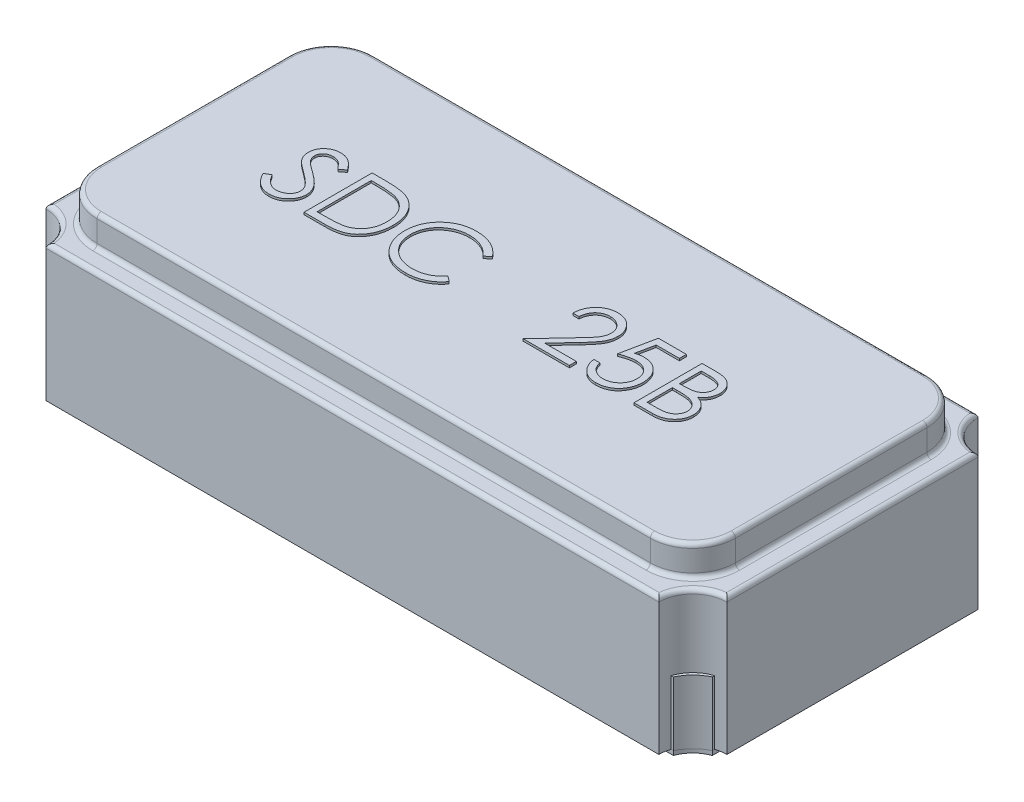
from build123d import *

# Parameters (mm, degrees)
EXTRUDE_2_DEPTH   = 0.02
EXTRUDE_2_2_DEPTH = 0.02
EXTRUDE_4_DEPTH   = 0.3
EXTRUDE_4_2_DEPTH = 0.3
EXTRUDE_4_3_DEPTH = 0.3
EXTRUDE_4_4_DEPTH = 0.3
EXTRUDE_8_DEPTH   = 0.64
SKETCH_7_W        = 3
SKETCH_7_H        = 1.3
EXTRUDE_9_DEPTH   = 0.14
FILLET_3_R        = 0.2
FILLET_4_R        = 0.02
FILLET_5_R        = 0.02
FILLET_6_R        = 0.02
EXTRUDE_10_DEPTH  = 0.01


with BuildPart() as part:
    # Эскиз2 → Бобышка-Вытянуть2 (new body)
    with BuildSketch(Plane(origin=(0, 0, 0), x_dir=(1, 0, 0), z_dir=(0, 1, 0))):
        with BuildLine():
            Line((-1.458578644, 0.7), (-0.825, 0.7))
            Line((-0.825, 0.7), (-0.825, 0.198360656))
            ThreePointArc((-0.825, 0.198360656), (-0.626639344, 0), (-0.825, -0.198360656))
            Line((-0.825, -0.198360656), (-0.825, -0.7))
            Line((-0.825, -0.7), (-1.458578644, -0.7))
            ThreePointArc((-1.458578644, -0.7), (-1.493933983, -0.643933983), (-1.55, -0.608578644))
            Line((-1.55, -0.608578644), (-1.55, 0.608578644))
            ThreePointArc((-1.55, 0.608578644), (-1.493933983, 0.643933983), (-1.458578644, 0.7))
        make_face()
    extrude(amount=EXTRUDE_2_DEPTH)


with BuildPart() as body_2:
    # Эскиз2 → Extrude 2 2 (new body)
    with BuildSketch(Plane(origin=(0, 0, 0), x_dir=(1, 0, 0), z_dir=(0, 1, 0))):
        with BuildLine():
            Line((1.55, 0.608578644), (1.55, -0.608578644))
            ThreePointArc((1.55, -0.608578644), (1.493933983, -0.643933983), (1.458578644, -0.7))
            Line((1.458578644, -0.7), (0.825, -0.7))
            Line((0.825, -0.7), (0.825, 0.7))
            Line((0.825, 0.7), (1.458578644, 0.7))
            ThreePointArc((1.458578644, 0.7), (1.493933983, 0.643933983), (1.55, 0.608578644))
        make_face()
    extrude(amount=EXTRUDE_2_2_DEPTH)


with BuildPart() as body_3:
    # Эскиз5 → Бобышка-Вытянуть4 (new body)
    with BuildSketch(Plane(origin=(0, 0.02, 0), x_dir=(-1, 0, 0), z_dir=(0, 1, 0))):
        with BuildLine():
            Line((1.458578644, 0.7), (1.436538459, 0.7))
            ThreePointArc((1.436538459, 0.7), (1.482556073, 0.632556073), (1.55, 0.586538459))
            Line((1.55, 0.586538459), (1.55, 0.608578644))
            ThreePointArc((1.55, 0.608578644), (1.496698209, 0.646698209), (1.458578644, 0.7))
        make_face()
    extrude(amount=EXTRUDE_4_DEPTH)


with BuildPart() as body_4:
    # Эскиз5 → Extrude 4 2 (new body)
    with BuildSketch(Plane(origin=(0, 0.02, 0), x_dir=(-1, 0, 0), z_dir=(0, 1, 0))):
        with BuildLine():
            Line((1.458578644, -0.7), (1.436538459, -0.7))
            ThreePointArc((1.436538459, -0.7), (1.482556073, -0.632556073), (1.55, -0.586538459))
            Line((1.55, -0.586538459), (1.55, -0.608578644))
            ThreePointArc((1.55, -0.608578644), (1.496698209, -0.646698209), (1.458578644, -0.7))
        make_face()
    extrude(amount=EXTRUDE_4_2_DEPTH)


with BuildPart() as body_5:
    # Эскиз5 → Extrude 4 3 (new body)
    with BuildSketch(Plane(origin=(0, 0.02, 0), x_dir=(-1, 0, 0), z_dir=(0, 1, 0))):
        with BuildLine():
            Line((-1.458578644, -0.7), (-1.436538459, -0.7))
            ThreePointArc((-1.436538459, -0.7), (-1.482556073, -0.632556073), (-1.55, -0.586538459))
            Line((-1.55, -0.586538459), (-1.55, -0.608578644))
            ThreePointArc((-1.55, -0.608578644), (-1.496698209, -0.646698209), (-1.458578644, -0.7))
        make_face()
    extrude(amount=EXTRUDE_4_3_DEPTH)


with BuildPart() as body_6:
    # Эскиз5 → Extrude 4 4 (new body)
    with BuildSketch(Plane(origin=(0, 0.02, 0), x_dir=(-1, 0, 0), z_dir=(0, 1, 0))):
        with BuildLine():
            Line((-1.55, 0.608578644), (-1.55, 0.586538459))
            ThreePointArc((-1.55, 0.586538459), (-1.482556073, 0.632556073), (-1.436538459, 0.7))
            Line((-1.436538459, 0.7), (-1.458578644, 0.7))
            ThreePointArc((-1.458578644, 0.7), (-1.496698209, 0.646698209), (-1.55, 0.608578644))
        make_face()
    extrude(amount=EXTRUDE_4_4_DEPTH)


with BuildPart() as body_7:
    # Эскиз6 → Бобышка-Вытянуть8 (new body)
    with BuildSketch(Plane(origin=(0, 0.02, 0), x_dir=(-1, 0, 0), z_dir=(0, 1, 0))):
        with BuildLine():
            Line((1.44, -0.75), (-1.44, -0.75))
            ThreePointArc((-1.44, -0.75), (-1.486862915, -0.636862915), (-1.6, -0.59))
            Line((-1.6, -0.59), (-1.6, 0.59))
            ThreePointArc((-1.6, 0.59), (-1.486862915, 0.636862915), (-1.44, 0.75))
            Line((-1.44, 0.75), (1.44, 0.75))
            ThreePointArc((1.44, 0.75), (1.486862915, 0.636862915), (1.6, 0.59))
            Line((1.6, 0.59), (1.6, -0.59))
            ThreePointArc((1.6, -0.59), (1.486862915, -0.636862915), (1.44, -0.75))
        make_face()
    extrude(amount=EXTRUDE_8_DEPTH)

    # Эскиз7 → Бобышка-Вытянуть9 (add)
    with BuildSketch(Plane(origin=(0, 0.66, 0), x_dir=(-1, 0, 0), z_dir=(0, 1, 0))):
        Rectangle(SKETCH_7_W, SKETCH_7_H)
    extrude(amount=EXTRUDE_9_DEPTH)

    # Скругление3
    # the kernel refuses this fillet: 0.2 mm, written as the material it takes off along each edge
    with BuildSketch(Plane(origin=(-1.5, 0.66, -0.65), x_dir=(1, 0, 0), z_dir=(0, 1, 0)), Plane(origin=(-1.5, 0.66, 0.65), x_dir=(0, 0, -1), z_dir=(0, 1, 0))) as fillet_3_piece_1:
        with BuildLine():
            CenterArc((FILLET_3_R, -FILLET_3_R), FILLET_3_R, 90, 90)
            Line((0, -FILLET_3_R), (0, 0))
            Line((0, 0), (FILLET_3_R, 0))
        make_face()
    extrude(amount=0.64, mode=Mode.SUBTRACT)
    with BuildSketch(Plane(origin=(1.5, 0.66, 0.65), x_dir=(0, 0, -1), z_dir=(0, 1, 0)), Plane(origin=(1.5, 0.66, -0.65), x_dir=(-1, 0, 0), z_dir=(0, 1, 0))) as fillet_3_piece_2:
        with BuildLine():
            CenterArc((FILLET_3_R, FILLET_3_R), FILLET_3_R, 180, 90)
            Line((0, FILLET_3_R), (0, 0))
            Line((0, 0), (FILLET_3_R, 0))
        make_face()
    extrude(amount=0.64, mode=Mode.SUBTRACT)

    # Скругление4
    fillet_4_edges = [body_7.edges().sort_by_distance(p)[0] for p in [
        (0, 0.8, -0.65),
        (1.5, 0.8, 0),
        (-1.5, 0.8, 0),
        (0, 0.8, 0.65),
        (-1.441421356, 0.8, 0.591421356),
        (-1.441421356, 0.8, -0.591421356),
        (1.441421356, 0.8, 0.591421356),
        (1.441421356, 0.8, -0.591421356),
    ]]
    fillet(fillet_4_edges, radius=FILLET_4_R)

    # Скругление5
    fillet_5_edges = [body_7.edges().sort_by_distance(p)[0] for p in [
        (0, 0.66, -0.65),
        (1.5, 0.66, 0),
        (0, 0.66, 0.65),
        (-1.5, 0.66, 0),
        (1.441421356, 0.66, -0.591421356),
        (1.441421356, 0.66, 0.591421356),
        (-1.441421356, 0.66, -0.591421356),
        (-1.441421356, 0.66, 0.591421356),
    ]]
    fillet(fillet_5_edges, radius=FILLET_5_R)

    # Скругление6
    fillet_6_edges = [body_7.edges().sort_by_distance(p)[0] for p in [
        (1.486862915, 0.66, 0.636862915),
        (1.6, 0.66, 0),
        (1.486862915, 0.66, -0.636862915),
        (0, 0.66, -0.75),
        (-1.486862915, 0.66, -0.636862915),
        (-1.6, 0.66, 0),
        (-1.486862915, 0.66, 0.636862915),
        (0, 0.66, 0.75),
    ]]
    fillet(fillet_6_edges, radius=FILLET_6_R)

    # Эскиз8 → Бобышка-Вытянуть10 (add)
    # profile 1 of 6: a face of its own
    with BuildSketch(Plane(origin=(0, 0.8, 0), x_dir=(-1, 0, 0), z_dir=(0, 1, 0))):
        with BuildLine():
            Line((1.065003615, 0.105091939), (1.037952333, 0.08887399))
            add(Edge.make_bspline(
                [(1.037952333, 0.08887399), (1.035436379, 0.093085591), (1.03061591, 0.101154856), (1.022574643, 0.112058448), (1.014242491, 0.121325846), (1.005557752, 0.128903135), (0.996573437, 0.134868748), (0.987230895, 0.139092952), (0.977561609, 0.141727555), (0.970981146, 0.142047563), (0.967695922, 0.142207324)],
                knots=[0, 0, 0, 0, 1.272034388, 2.437168799, 3.508375237, 4.49857839, 5.41946034, 6.295179144, 7.148887113, 8, 8, 8, 8], degree=3))
            add(Edge.make_bspline(
                [(0.967695922, 0.142207324), (0.964890834, 0.142127323), (0.95932974, 0.141968722), (0.951126874, 0.140506339), (0.943200091, 0.138113891), (0.935628286, 0.134870641), (0.92861171, 0.130884079), (0.92236114, 0.126182832), (0.917079843, 0.120751923), (0.912713642, 0.114787168), (0.909295708, 0.108413077), (0.906863767, 0.101786625), (0.90530154, 0.094950038), (0.905103473, 0.090313907), (0.905003615, 0.087976554)],
                knots=[0, 0, 0, 0, 1.095645842, 2.172120455, 3.244862764, 4.326153987, 5.384857088, 6.392105572, 7.372507978, 8.334705661, 9.272564127, 10.189475455, 11.087205874, 12, 12, 12, 12], degree=3))
            add(Edge.make_bspline(
                [(0.905003615, 0.087976554), (0.905135514, 0.085311359), (0.905402624, 0.079914047), (0.907756681, 0.071937323), (0.911351228, 0.064009345), (0.914729699, 0.059104456), (0.916477974, 0.056566298)],
                knots=[0, 0, 0, 0, 0.938992559, 1.901562324, 2.914110574, 4, 4, 4, 4], degree=3))
            add(Edge.make_bspline(
                [(0.916477974, 0.056566298), (0.917906449, 0.054729467), (0.920914157, 0.050861949), (0.926160993, 0.045206113), (0.932126976, 0.039217626), (0.938966567, 0.033016017), (0.946580032, 0.026474429), (0.955053684, 0.019714182), (0.964288581, 0.01263445), (0.970802222, 0.007958491), (0.974170281, 0.005540657)],
                knots=[0, 0, 0, 0, 0.722283655, 1.520795216, 2.39349503, 3.346893347, 4.386874146, 5.510198126, 6.712579003, 8, 8, 8, 8], degree=3))
            add(Edge.make_bspline(
                [(0.974170281, 0.005540657), (0.977536598, 0.003142066), (0.983972738, -0.001443858), (0.992980471, -0.008241268), (1.001024568, -0.014495636), (1.008146017, -0.020119842), (1.014160578, -0.025359184), (1.019288125, -0.029932863), (1.023339484, -0.034085108), (1.02559397, -0.03677658), (1.026606179, -0.037984984)],
                knots=[0, 0, 0, 0, 1.452255772, 2.776602448, 3.96446981, 5.032613149, 5.964194703, 6.766668629, 7.446264616, 8, 8, 8, 8], degree=3))
            add(Edge.make_bspline(
                [(1.026606179, -0.037984984), (1.028020574, -0.039868601), (1.030802173, -0.043572986), (1.034477872, -0.049361355), (1.037577599, -0.05527542), (1.0400723, -0.061336615), (1.04208967, -0.067499387), (1.04349226, -0.073810002), (1.044356787, -0.080225622), (1.04444609, -0.084542135), (1.044490794, -0.086702933)],
                knots=[0, 0, 0, 0, 1.068019517, 2.100403715, 3.106014851, 4.09224787, 5.069873182, 6.043214339, 7.020455327, 8, 8, 8, 8], degree=3))
            add(Edge.make_bspline(
                [(1.044490794, -0.086702933), (1.044371987, -0.090088802), (1.044136911, -0.096788171), (1.042132434, -0.106569638), (1.03900599, -0.115937276), (1.034482743, -0.124682595), (1.028895686, -0.132793199), (1.022263838, -0.140125211), (1.014463005, -0.146426255), (1.005778685, -0.151782646), (0.996384041, -0.156055852), (0.986510821, -0.159169577), (0.97620339, -0.16099441), (0.969198806, -0.161251813), (0.96564464, -0.16138242)],
                knots=[0, 0, 0, 0, 1.005367131, 1.989245246, 2.955191616, 3.932180104, 4.904534562, 5.875498653, 6.859376768, 7.874484044, 8.900379497, 9.918679785, 10.943926428, 12, 12, 12, 12], degree=3))
            add(Edge.make_bspline(
                [(0.96564464, -0.16138242), (0.961872586, -0.16125655), (0.95439215, -0.161006935), (0.943385565, -0.158703118), (0.932725191, -0.155123587), (0.924181738, -0.150860434), (0.917492768, -0.146648447), (0.912397073, -0.14280227), (0.907205168, -0.138383946), (0.901972993, -0.133299876), (0.896648854, -0.127651878), (0.891257287, -0.121392104), (0.885747833, -0.114576974), (0.88220464, -0.109710526), (0.88038823, -0.107215753)],
                knots=[0, 0, 0, 0, 1.286534051, 2.551350862, 3.822568981, 5.117864672, 5.799956111, 6.519305446, 7.295594771, 8.126302591, 9.008831062, 9.944975596, 10.946496709, 12, 12, 12, 12], degree=3))
            Line((0.88038823, -0.107215753), (0.906349768, -0.087536266))
            add(Edge.make_bspline(
                [(0.906349768, -0.087536266), (0.907917282, -0.08955592), (0.910935947, -0.093445302), (0.915520735, -0.098890267), (0.919835459, -0.103870759), (0.92411904, -0.108185316), (0.928041285, -0.112157077), (0.931915707, -0.115497085), (0.935592632, -0.118311376), (0.940216774, -0.121318686), (0.946089448, -0.12422828), (0.953392672, -0.126729838), (0.961029786, -0.128267193), (0.966214454, -0.128462589), (0.968849768, -0.128561907)],
                knots=[0, 0, 0, 0, 1.181426797, 2.275151783, 3.28963443, 4.225459815, 5.084396437, 5.868484344, 6.587427557, 7.222918358, 8.415355282, 9.605213164, 10.782753814, 12, 12, 12, 12], degree=3))
            add(Edge.make_bspline(
                [(0.968849768, -0.128561907), (0.972156288, -0.128452937), (0.978532599, -0.128242799), (0.987564004, -0.125887382), (0.995739679, -0.122306129), (1.002747519, -0.117142), (1.008533784, -0.110985363), (1.012771288, -0.103964152), (1.015304817, -0.096209498), (1.015614917, -0.090802688), (1.015772845, -0.088049087)],
                knots=[0, 0, 0, 0, 1.144248881, 2.206576175, 3.214949548, 4.222996039, 5.203671638, 6.127710127, 7.046472867, 8, 8, 8, 8], degree=3))
            add(Edge.make_bspline(
                [(1.015772845, -0.088049087), (1.015733151, -0.086335509), (1.015653208, -0.082884484), (1.014700098, -0.077796311), (1.013277781, -0.072768037), (1.011261686, -0.067770692), (1.00852179, -0.062661907), (1.004800529, -0.057470801), (1.000143864, -0.052067452), (0.996569996, -0.048556572), (0.994683102, -0.046702933)],
                knots=[0, 0, 0, 0, 0.858500039, 1.728959331, 2.587258638, 3.476905708, 4.426389682, 5.487945037, 6.673710648, 8, 8, 8, 8], degree=3))
            add(Edge.make_bspline(
                [(0.994683102, -0.046702933), (0.993982633, -0.046077833), (0.992318481, -0.04459274), (0.989276111, -0.042161446), (0.985258483, -0.039162335), (0.980370511, -0.035451495), (0.974522066, -0.031146904), (0.967712507, -0.026303602), (0.960017738, -0.02076436), (0.954557449, -0.016891671), (0.951670281, -0.014843958)],
                knots=[0, 0, 0, 0, 0.420754252, 0.999615792, 1.744751191, 2.668019286, 3.750313428, 4.999500688, 6.413464383, 8, 8, 8, 8], degree=3))
            add(Edge.make_bspline(
                [(0.951670281, -0.014843958), (0.948197286, -0.012316747), (0.941472312, -0.007423151), (0.931903586, -7.0885e-05), (0.923227694, 0.007119851), (0.915413534, 0.014102669), (0.908386058, 0.020826163), (0.902216106, 0.027366009), (0.896875684, 0.033679321), (0.891047821, 0.041718339), (0.885163407, 0.051682995), (0.880118006, 0.063897082), (0.876908208, 0.076146219), (0.876491344, 0.084368473), (0.876285666, 0.088425272)],
                knots=[0, 0, 0, 0, 1.163604038, 2.253157948, 3.268574773, 4.215621239, 5.091738613, 5.902582348, 6.650434646, 7.330118262, 8.591011492, 9.77460283, 10.902005569, 12, 12, 12, 12], degree=3))
            add(Edge.make_bspline(
                [(0.876285666, 0.088425272), (0.876345842, 0.091294098), (0.876465025, 0.09697604), (0.877831504, 0.105320132), (0.879840705, 0.113420659), (0.882835179, 0.121176812), (0.886578358, 0.128675035), (0.891135648, 0.13590218), (0.896658566, 0.142739498), (0.902793864, 0.149319771), (0.909608628, 0.155270978), (0.91682004, 0.160571624), (0.924387623, 0.165110156), (0.932397799, 0.168675727), (0.940718618, 0.171527879), (0.949389138, 0.173572227), (0.95842799, 0.174831202), (0.964572123, 0.17496156), (0.967695922, 0.175027836)],
                knots=[0, 0, 0, 0, 0.98378539, 1.948466333, 2.894822735, 3.844243623, 4.795447569, 5.768042124, 6.770299647, 7.807997672, 8.852593179, 9.870666288, 10.876941106, 11.874841786, 12.874492863, 13.892063892, 14.928283473, 16, 16, 16, 16], degree=3))
            add(Edge.make_bspline(
                [(0.967695922, 0.175027836), (0.970112761, 0.174980564), (0.974916002, 0.174886615), (0.982001505, 0.174075723), (0.988956897, 0.17288654), (0.995694847, 0.171073468), (1.002299244, 0.168821915), (1.008711251, 0.166065234), (1.014946333, 0.162783468), (1.021012194, 0.158971541), (1.026964353, 0.154577284), (1.032778788, 0.149503652), (1.038484605, 0.143774929), (1.044105507, 0.137399087), (1.049509085, 0.13027074), (1.054831223, 0.122502933), (1.060044209, 0.114070573), (1.063319602, 0.108140718), (1.065003615, 0.105091939)],
                knots=[0, 0, 0, 0, 0.915366252, 1.81920441, 2.69897508, 3.586533125, 4.459536084, 5.340758185, 6.227946952, 7.126403341, 8.052553006, 9.028121456, 10.047063623, 11.114014537, 12.24582441, 13.433687931, 14.680555077, 16, 16, 16, 16], degree=3))
        make_face()
    # profile 2 of 6: a face of its own
    with BuildSketch(Plane(origin=(0, 0.8, 0), x_dir=(-1, 0, 0), z_dir=(0, 1, 0))):
        with BuildLine():
            Line((0.81064464, 0.166822708), (0.81064464, -0.153177292))
            Line((0.81064464, -0.153177292), (0.746029256, -0.153177292))
            add(Edge.make_bspline(
                [(0.746029256, -0.153177292), (0.740409222, -0.153136938), (0.729551347, -0.153058976), (0.713861222, -0.152561829), (0.699364556, -0.151691255), (0.686069579, -0.150398701), (0.673954934, -0.148847274), (0.663040022, -0.146874246), (0.653307155, -0.144553831), (0.647321389, -0.142574725), (0.644490794, -0.14163883)],
                knots=[0, 0, 0, 0, 1.314317071, 2.539253741, 3.67075822, 4.709970291, 5.662644612, 6.526156501, 7.303037452, 8, 8, 8, 8], degree=3))
            add(Edge.make_bspline(
                [(0.644490794, -0.14163883), (0.640788087, -0.140228461), (0.633466637, -0.137439704), (0.623047936, -0.132171058), (0.613206628, -0.126225862), (0.604020422, -0.119467811), (0.595469076, -0.111983267), (0.587444996, -0.103832785), (0.580178177, -0.094798774), (0.573417984, -0.085161557), (0.567501061, -0.074833433), (0.562283473, -0.064021273), (0.557828444, -0.052746056), (0.554352325, -0.040925511), (0.55148045, -0.02867317), (0.549553493, -0.015896269), (0.548273492, -0.002669297), (0.548145487, 0.00630677), (0.548080538, 0.01086117)],
                knots=[0, 0, 0, 0, 0.984696416, 1.947063185, 2.89840987, 3.841051395, 4.778753227, 5.721858861, 6.681155121, 7.65838316, 8.646299769, 9.637283673, 10.641736726, 11.657050558, 12.698485921, 13.768600492, 14.86780186, 16, 16, 16, 16], degree=3))
            add(Edge.make_bspline(
                [(0.548080538, 0.01086117), (0.548138082, 0.01481647), (0.548251479, 0.022610801), (0.549268461, 0.034098161), (0.550749468, 0.045243843), (0.553031865, 0.055998908), (0.55583642, 0.066435767), (0.559297956, 0.076505003), (0.563400756, 0.086213459), (0.568158838, 0.095484024), (0.573368744, 0.104294156), (0.579045792, 0.112504263), (0.584995603, 0.120204866), (0.591435178, 0.127221998), (0.598151309, 0.133774177), (0.605372421, 0.139570746), (0.612872412, 0.144880811), (0.620876604, 0.149543113), (0.629450668, 0.153690369), (0.638818571, 0.157192752), (0.648946123, 0.160206813), (0.659900431, 0.162608211), (0.671644962, 0.164543859), (0.684211551, 0.165832902), (0.697576668, 0.166707033), (0.706754231, 0.166783401), (0.711477974, 0.166822708)],
                knots=[0, 0, 0, 0, 1.105894396, 2.179280415, 3.222964075, 4.248423888, 5.251546139, 6.243661943, 7.223682738, 8.196462441, 9.155694589, 10.083899862, 10.986397372, 11.874737962, 12.745335529, 13.607670254, 14.461432187, 15.313100333, 16.195087267, 17.121790994, 18.106827133, 19.14775296, 20.255889161, 21.433815148, 22.679170477, 24, 24, 24, 24], degree=3))
            Line((0.711477974, 0.166822708), (0.81064464, 0.166822708))
        make_face()
        with BuildLine():
            Line((0.781926692, 0.134002195), (0.745195922, 0.134002195))
            add(Edge.make_bspline(
                [(0.745195922, 0.134002195), (0.7399179, 0.133979512), (0.72976633, 0.133935884), (0.715169027, 0.133553054), (0.701831482, 0.132927506), (0.689751801, 0.13205207), (0.678936805, 0.130893797), (0.669363891, 0.129602377), (0.661064438, 0.127993467), (0.656042318, 0.126535094), (0.653721563, 0.12586117)],
                knots=[0, 0, 0, 0, 1.375205317, 2.645023457, 3.804390687, 4.853969522, 5.800190428, 6.637939096, 7.370582563, 8, 8, 8, 8], degree=3))
            add(Edge.make_bspline(
                [(0.653721563, 0.12586117), (0.650800508, 0.124832533), (0.645028167, 0.122799828), (0.636719937, 0.119090587), (0.628967414, 0.11470227), (0.621641355, 0.109795518), (0.614788843, 0.104294567), (0.60844161, 0.098181922), (0.602549523, 0.09152835), (0.597206918, 0.084311433), (0.592374956, 0.076611245), (0.588200157, 0.068436364), (0.584680848, 0.059832664), (0.581793489, 0.05083008), (0.579542339, 0.041423253), (0.577957441, 0.031588576), (0.576975299, 0.021329934), (0.576858066, 0.014346304), (0.576798486, 0.010797067)],
                knots=[0, 0, 0, 0, 0.998420628, 1.972994, 2.929372424, 3.86770908, 4.81360496, 5.759023883, 6.706048443, 7.676227424, 8.651287839, 9.634325482, 10.632389399, 11.645655052, 12.680158286, 13.74837235, 14.855672678, 16, 16, 16, 16], degree=3))
            add(Edge.make_bspline(
                [(0.576798486, 0.010797067), (0.576845466, 0.0070546), (0.576937756, -0.00029751), (0.578095841, -0.011085548), (0.57979181, -0.021459771), (0.582231329, -0.031427647), (0.585382976, -0.040976208), (0.589154178, -0.0501594), (0.593733009, -0.058859042), (0.59891673, -0.067148819), (0.604736406, -0.074903186), (0.611166221, -0.082031297), (0.618138377, -0.08854643), (0.625620742, -0.094458958), (0.633717931, -0.099663735), (0.642292923, -0.104293823), (0.65146651, -0.108227822), (0.657849506, -0.11031945), (0.661093358, -0.11138242)],
                knots=[0, 0, 0, 0, 1.122272916, 2.204715076, 3.251197285, 4.274229216, 5.279697671, 6.265416158, 7.248880903, 8.225321784, 9.195852973, 10.153576302, 11.101466393, 12.055578741, 13.010401466, 13.985536859, 14.976245305, 16, 16, 16, 16], degree=3))
            add(Edge.make_bspline(
                [(0.661093358, -0.11138242), (0.663776892, -0.112124493), (0.66948282, -0.113702345), (0.678793857, -0.115423522), (0.689272956, -0.116941648), (0.700966643, -0.118226954), (0.713861588, -0.119149223), (0.727967708, -0.119841458), (0.7432911, -0.12030835), (0.753913503, -0.120340232), (0.759426692, -0.120356779)],
                knots=[0, 0, 0, 0, 0.674548936, 1.434276114, 2.292660221, 3.240891867, 4.284742987, 5.42552168, 6.663806718, 8, 8, 8, 8], degree=3))
            Line((0.759426692, -0.120356779), (0.781926692, -0.120356779))
            Line((0.781926692, -0.120356779), (0.781926692, 0.134002195))
        make_face(mode=Mode.SUBTRACT)
    # profile 3 of 6: a face of its own
    with BuildSketch(Plane(origin=(0, 0.8, 0), x_dir=(-1, 0, 0), z_dir=(0, 1, 0))):
        with BuildLine():
            Line((0.187054897, -0.094459343), (0.212183102, -0.075228574))
            add(Edge.make_bspline(
                [(0.212183102, -0.075228574), (0.213975659, -0.077364863), (0.217536604, -0.081608639), (0.223265176, -0.087568327), (0.229236622, -0.093149883), (0.235442634, -0.09838917), (0.242026835, -0.10307561), (0.248738347, -0.107574187), (0.255821029, -0.111512845), (0.26556529, -0.11632441), (0.27836215, -0.121235801), (0.294415622, -0.125460021), (0.311196954, -0.128123718), (0.322643154, -0.128414171), (0.328465153, -0.128561907)],
                knots=[0, 0, 0, 0, 0.75789156, 1.505565099, 2.245254514, 2.979266606, 3.711207489, 4.440978832, 5.174393176, 5.91211879, 7.394186119, 8.890401545, 10.418332761, 12, 12, 12, 12], degree=3))
            add(Edge.make_bspline(
                [(0.328465153, -0.128561907), (0.33167273, -0.128524807), (0.338058115, -0.12845095), (0.347535122, -0.127483433), (0.356853113, -0.126107914), (0.365977439, -0.124116565), (0.374889982, -0.121524009), (0.383658603, -0.118483633), (0.392180034, -0.114700195), (0.400556819, -0.110521887), (0.408581998, -0.105801188), (0.416176709, -0.100653679), (0.423306701, -0.095130213), (0.429990106, -0.089243843), (0.436159579, -0.082925848), (0.441880661, -0.076247215), (0.44714605, -0.069177783), (0.451950312, -0.061751331), (0.456247421, -0.054004542), (0.459973713, -0.045970693), (0.463123524, -0.037680475), (0.465678849, -0.029151655), (0.467678751, -0.020414422), (0.469063109, -0.011437493), (0.470021713, -0.00223656), (0.470094919, 0.003999701), (0.47013182, 0.007143221)],
                knots=[0, 0, 0, 0, 1.054960097, 2.100129169, 3.131228542, 4.15308236, 5.169990287, 6.183953224, 7.204064171, 8.235355279, 9.262684623, 10.264978336, 11.252191258, 12.228402777, 13.192898315, 14.155264692, 15.119862721, 16.091023151, 17.063429752, 18.032246104, 19.00241354, 19.978852882, 20.959535218, 21.948948728, 22.966123959, 24, 24, 24, 24], degree=3))
            add(Edge.make_bspline(
                [(0.47013182, 0.007143221), (0.470016183, 0.011872836), (0.469789145, 0.021158809), (0.467777138, 0.03476219), (0.464695136, 0.047806748), (0.460151681, 0.06020416), (0.454437565, 0.072057774), (0.447307924, 0.08322384), (0.439019299, 0.093865943), (0.429486657, 0.103726339), (0.41902642, 0.112733181), (0.407803827, 0.120664697), (0.395846388, 0.127276334), (0.383286244, 0.132778137), (0.370026712, 0.137007323), (0.356091645, 0.139984615), (0.341511348, 0.141926757), (0.331548431, 0.142112694), (0.326477974, 0.142207324)],
                knots=[0, 0, 0, 0, 1.029159485, 2.020618137, 2.987588728, 3.942669054, 4.889339625, 5.846988364, 6.821327795, 7.821533711, 8.827683044, 9.822769455, 10.807800696, 11.797391277, 12.803701919, 13.832062008, 14.896664671, 16, 16, 16, 16], degree=3))
            add(Edge.make_bspline(
                [(0.326477974, 0.142207324), (0.320891442, 0.142052921), (0.309895811, 0.141749019), (0.293770735, 0.13917446), (0.278334322, 0.135000021), (0.263585743, 0.129157926), (0.249566575, 0.121563385), (0.23625488, 0.112356722), (0.223639422, 0.10145036), (0.216053477, 0.09312276), (0.212183102, 0.08887399)],
                knots=[0, 0, 0, 0, 1.028121516, 2.023589091, 2.998037872, 3.967518031, 4.937445131, 5.927275754, 6.942489185, 8, 8, 8, 8], degree=3))
            Line((0.212183102, 0.08887399), (0.187054897, 0.107912452))
            add(Edge.make_bspline(
                [(0.187054897, 0.107912452), (0.189077192, 0.110521596), (0.193112096, 0.115727386), (0.199644389, 0.123067787), (0.206530665, 0.129966257), (0.213789513, 0.136386869), (0.221430412, 0.142361716), (0.229450019, 0.147863016), (0.237808337, 0.152951795), (0.246515832, 0.157564175), (0.255572979, 0.161668423), (0.264902162, 0.165255526), (0.27452047, 0.168267591), (0.284352054, 0.170798349), (0.294497933, 0.172605793), (0.304842022, 0.174044243), (0.31548063, 0.174897827), (0.322651677, 0.174984111), (0.326285666, 0.175027836)],
                knots=[0, 0, 0, 0, 0.986880684, 1.969034265, 2.935876267, 3.899990983, 4.864973347, 5.834408638, 6.8063673, 7.789580233, 8.778939794, 9.778051223, 10.776304221, 11.791326552, 12.811423977, 13.855999788, 14.91350973, 16, 16, 16, 16], degree=3))
            add(Edge.make_bspline(
                [(0.326285666, 0.175027836), (0.329727373, 0.175003883), (0.336532921, 0.174956518), (0.346580807, 0.174189234), (0.356362712, 0.173142401), (0.365850678, 0.17156616), (0.375096481, 0.169706106), (0.384016306, 0.167212734), (0.392697925, 0.164419667), (0.401106459, 0.161136926), (0.40924906, 0.157432589), (0.417099466, 0.153245932), (0.424654065, 0.148612162), (0.431987132, 0.143633418), (0.43899034, 0.138149779), (0.445724377, 0.132237401), (0.452227003, 0.125916211), (0.456250106, 0.121358053), (0.458272845, 0.119066298)],
                knots=[0, 0, 0, 0, 1.114604814, 2.203992996, 3.262667896, 4.300477797, 5.318619304, 6.316056647, 7.298880507, 8.271930387, 9.238335007, 10.195173496, 11.151986948, 12.108099108, 13.064862484, 14.031167946, 15.010108607, 16, 16, 16, 16], degree=3))
            add(Edge.make_bspline(
                [(0.458272845, 0.119066298), (0.461512464, 0.115085307), (0.467952591, 0.107171388), (0.476195764, 0.09434645), (0.483228351, 0.080968052), (0.48897793, 0.066958703), (0.493394277, 0.052312959), (0.496499256, 0.037054378), (0.498502894, 0.021213464), (0.49873287, 0.010439967), (0.498849768, 0.004963734)],
                knots=[0, 0, 0, 0, 0.994611881, 1.977215934, 2.950189954, 3.921972279, 4.908960509, 5.911694611, 6.938501887, 8, 8, 8, 8], degree=3))
            add(Edge.make_bspline(
                [(0.498849768, 0.004963734), (0.498706943, -0.000791952), (0.498425944, -0.012115906), (0.496058262, -0.028738676), (0.49220322, -0.044641548), (0.4868948, -0.059885714), (0.479891576, -0.074383951), (0.471413606, -0.088197492), (0.461378082, -0.101315057), (0.449911039, -0.113568938), (0.437332792, -0.124772238), (0.423863816, -0.134628883), (0.409529421, -0.142831606), (0.394487801, -0.149688404), (0.37862625, -0.154958753), (0.361978629, -0.158648188), (0.344576213, -0.16094461), (0.332703077, -0.161234915), (0.326670281, -0.16138242)],
                knots=[0, 0, 0, 0, 1.032901378, 2.032168977, 3.007206631, 3.966850309, 4.924221947, 5.891988639, 6.871730993, 7.884084801, 8.900290346, 9.89161143, 10.874607481, 11.860025555, 12.854717796, 13.869097222, 14.917278314, 16, 16, 16, 16], degree=3))
            add(Edge.make_bspline(
                [(0.326670281, -0.16138242), (0.322993534, -0.161338333), (0.315715784, -0.161251068), (0.304949757, -0.160400299), (0.294468432, -0.158981624), (0.284242651, -0.157048205), (0.274255549, -0.154643404), (0.264552007, -0.151632275), (0.255159828, -0.147991621), (0.246015682, -0.143939663), (0.237236812, -0.139299077), (0.228827584, -0.13425497), (0.22085628, -0.128710207), (0.213271082, -0.122745658), (0.206107059, -0.116315439), (0.199256694, -0.109527632), (0.192923389, -0.102202179), (0.189014642, -0.097045013), (0.187054897, -0.094459343)],
                knots=[0, 0, 0, 0, 1.096566765, 2.170543479, 3.218870886, 4.250164525, 5.273529809, 6.281496242, 7.278154839, 8.276706968, 9.263143576, 10.238168486, 11.199979644, 12.157579042, 13.114563119, 14.070017788, 15.032356758, 16, 16, 16, 16], degree=3))
        make_face()
    # profile 4 of 6: a face of its own
    with BuildSketch(Plane(origin=(0, 0.8, 0), x_dir=(-1, 0, 0), z_dir=(0, 1, 0))):
        with BuildLine():
            Line((-0.260124591, -0.054715753), (-0.231406642, -0.054715753))
            add(Edge.make_bspline(
                [(-0.231406642, -0.054715753), (-0.231593778, -0.058525682), (-0.231961309, -0.06600828), (-0.233683204, -0.076917629), (-0.236144738, -0.087346458), (-0.239633306, -0.097205359), (-0.243941384, -0.106612106), (-0.249215717, -0.115441788), (-0.255343866, -0.123782037), (-0.262314588, -0.131474947), (-0.269878465, -0.138507228), (-0.277990175, -0.144644226), (-0.286566348, -0.149770063), (-0.295532595, -0.154078448), (-0.304992615, -0.157308488), (-0.314855981, -0.159706177), (-0.325167274, -0.161148508), (-0.332192639, -0.161303562), (-0.335765616, -0.16138242)],
                knots=[0, 0, 0, 0, 1.100776268, 2.161895295, 3.184016182, 4.190939212, 5.176500551, 6.166955529, 7.155448256, 8.160289653, 9.16017456, 10.133824356, 11.091467644, 12.04088621, 13.000931625, 13.972173743, 14.968683325, 16, 16, 16, 16], degree=3))
            add(Edge.make_bspline(
                [(-0.335765616, -0.16138242), (-0.339274716, -0.161300942), (-0.346169971, -0.161140841), (-0.35622929, -0.159745259), (-0.365828293, -0.157606655), (-0.374858195, -0.15443758), (-0.383411668, -0.150461085), (-0.391382804, -0.145515792), (-0.398964356, -0.139835696), (-0.405784233, -0.133135745), (-0.412049113, -0.125986879), (-0.41744906, -0.118351951), (-0.422099538, -0.1104572), (-0.425905808, -0.102240958), (-0.42879113, -0.093676466), (-0.430928878, -0.084845838), (-0.432150929, -0.07564716), (-0.432337453, -0.069420096), (-0.432432283, -0.066254215)],
                knots=[0, 0, 0, 0, 1.111674182, 2.184400057, 3.212814286, 4.223731311, 5.211378316, 6.196328225, 7.191884489, 8.207283132, 9.220262353, 10.201199469, 11.166417575, 12.120932471, 13.06540007, 14.026332106, 14.996573967, 16, 16, 16, 16], degree=3))
            add(Edge.make_bspline(
                [(-0.432432283, -0.066254215), (-0.432277468, -0.061797272), (-0.431970555, -0.052961599), (-0.429345276, -0.039977355), (-0.425244888, -0.027397492), (-0.420308424, -0.017272594), (-0.415327107, -0.009114875), (-0.410842707, -0.002394897), (-0.405563119, 0.00483881), (-0.39953345, 0.012615522), (-0.392649861, 0.020833397), (-0.385091185, 0.029660103), (-0.376662218, 0.038932426), (-0.370751486, 0.045269674), (-0.367688693, 0.048553477)],
                knots=[0, 0, 0, 0, 1.184416499, 2.348048165, 3.509039915, 4.696071444, 5.333504901, 6.05069495, 6.844171097, 7.714965912, 8.667477798, 9.695072654, 10.805644396, 12, 12, 12, 12], degree=3))
            Line((-0.367688693, 0.048553477), (-0.287624591, 0.134002195))
            Line((-0.287624591, 0.134002195), (-0.436534847, 0.134002195))
            Line((-0.436534847, 0.134002195), (-0.436534847, 0.166822708))
            Line((-0.436534847, 0.166822708), (-0.21909895, 0.166822708))
            Line((-0.21909895, 0.166822708), (-0.343201514, 0.034386811))
            add(Edge.make_bspline(
                [(-0.343201514, 0.034386811), (-0.346223249, 0.031232852), (-0.352027383, 0.025174743), (-0.360233261, 0.016327409), (-0.367615315, 0.008129252), (-0.37417844, 0.000543945), (-0.379928038, -0.00638551), (-0.384845712, -0.012713419), (-0.388953196, -0.018385477), (-0.393306274, -0.025048774), (-0.397457223, -0.03319392), (-0.401105482, -0.043097645), (-0.403314089, -0.053315299), (-0.403580385, -0.060217996), (-0.403714334, -0.063690112)],
                knots=[0, 0, 0, 0, 1.329530082, 2.553755191, 3.672934919, 4.687409497, 5.60679272, 6.413407421, 7.126401618, 7.737995624, 8.834647426, 9.90044882, 10.943907757, 12, 12, 12, 12], degree=3))
            add(Edge.make_bspline(
                [(-0.403714334, -0.063690112), (-0.403656806, -0.065873796), (-0.40354343, -0.070177416), (-0.402523873, -0.076483052), (-0.401025943, -0.082589158), (-0.39871717, -0.088420236), (-0.395943263, -0.094090971), (-0.392399393, -0.099428957), (-0.388349681, -0.104616152), (-0.383652212, -0.109474691), (-0.378495265, -0.113925868), (-0.373046471, -0.117868557), (-0.367281936, -0.121163583), (-0.361225684, -0.123864697), (-0.354894673, -0.125983591), (-0.348276639, -0.127451803), (-0.341389872, -0.12837363), (-0.336687381, -0.128498355), (-0.334291257, -0.128561907)],
                knots=[0, 0, 0, 0, 0.991504627, 1.954065223, 2.895985987, 3.842598665, 4.797835564, 5.759220273, 6.74786863, 7.784730864, 8.824135544, 9.839918996, 10.835834653, 11.835434876, 12.84861661, 13.863796685, 14.911511676, 16, 16, 16, 16], degree=3))
            add(Edge.make_bspline(
                [(-0.334291257, -0.128561907), (-0.331788142, -0.128499132), (-0.326872437, -0.128375852), (-0.319670602, -0.127441494), (-0.3127522, -0.126026457), (-0.306223842, -0.123773728), (-0.299948899, -0.121137204), (-0.29408745, -0.117723369), (-0.288474839, -0.113822534), (-0.283223909, -0.109274409), (-0.278441446, -0.104140261), (-0.274090797, -0.098551831), (-0.270404448, -0.092410048), (-0.267132114, -0.085862286), (-0.264629425, -0.078728651), (-0.262489805, -0.071183605), (-0.260935616, -0.063119497), (-0.260399422, -0.057563527), (-0.260124591, -0.054715753)],
                knots=[0, 0, 0, 0, 1.031072318, 2.024855787, 2.988461151, 3.935103592, 4.865765533, 5.788564469, 6.724086513, 7.67908574, 8.64457978, 9.611397706, 10.591395687, 11.591555111, 12.622101007, 13.700900657, 14.821571223, 16, 16, 16, 16], degree=3))
        make_face()
    # profile 5 of 6: a face of its own
    with BuildSketch(Plane(origin=(0, 0.8, 0), x_dir=(-1, 0, 0), z_dir=(0, 1, 0))):
        with BuildLine():
            Line((-0.666278437, -0.153177292), (-0.666278437, -0.120356779))
            Line((-0.666278437, -0.120356779), (-0.557432283, -0.120356779))
            Line((-0.557432283, -0.120356779), (-0.540188693, -0.036190112))
            add(Edge.make_bspline(
                [(-0.540188693, -0.036190112), (-0.543576659, -0.037125451), (-0.550140306, -0.038937523), (-0.559828065, -0.040949479), (-0.569025067, -0.04216232), (-0.5749931, -0.042327925), (-0.577881001, -0.042408061)],
                knots=[0, 0, 0, 0, 1.100273476, 2.13160584, 3.095893838, 4, 4, 4, 4], degree=3))
            add(Edge.make_bspline(
                [(-0.577881001, -0.042408061), (-0.581455015, -0.042333252), (-0.58848242, -0.04218616), (-0.598748588, -0.04069057), (-0.608597308, -0.038522867), (-0.617886919, -0.035188526), (-0.626767187, -0.031090459), (-0.635117718, -0.025995848), (-0.642977739, -0.019977288), (-0.650330067, -0.013158243), (-0.656958449, -0.005565983), (-0.662741357, 0.002603967), (-0.667684356, 0.011260442), (-0.671627406, 0.020483068), (-0.674824357, 0.03018493), (-0.676938184, 0.040447439), (-0.678348521, 0.051185208), (-0.678505884, 0.058527388), (-0.678586129, 0.062271426)],
                knots=[0, 0, 0, 0, 1.052656913, 2.069786496, 3.052102726, 4.020122636, 4.972424848, 5.930457368, 6.896570172, 7.885826804, 8.881139003, 9.861434336, 10.831623367, 11.813212553, 12.812997731, 13.836986694, 14.897002833, 16, 16, 16, 16], degree=3))
            add(Edge.make_bspline(
                [(-0.678586129, 0.062271426), (-0.678525276, 0.064879159), (-0.678404391, 0.070059384), (-0.677790803, 0.077752757), (-0.676605568, 0.085282371), (-0.675031342, 0.092633312), (-0.672938065, 0.09981655), (-0.67046266, 0.106849034), (-0.667499768, 0.113719129), (-0.664118703, 0.120392649), (-0.660271938, 0.126738244), (-0.656166575, 0.132829853), (-0.651693154, 0.138490752), (-0.646929985, 0.143815565), (-0.641785612, 0.148651139), (-0.636386276, 0.153199194), (-0.63061124, 0.157266815), (-0.624562311, 0.16100786), (-0.618243734, 0.164357512), (-0.611591322, 0.167151703), (-0.604751145, 0.16960084), (-0.597662229, 0.171592491), (-0.59033831, 0.173137724), (-0.582754166, 0.174190006), (-0.574947853, 0.174955634), (-0.569656435, 0.175003605), (-0.566983565, 0.175027836)],
                knots=[0, 0, 0, 0, 1.056281413, 2.098288097, 3.122646807, 4.141030392, 5.140675379, 6.150604744, 7.15845591, 8.168533554, 9.177684096, 10.161739049, 11.141561652, 12.097360316, 13.052218386, 13.998410789, 14.954052752, 15.909851415, 16.877523809, 17.846742625, 18.829312613, 19.818263486, 20.826374662, 21.858017533, 22.918014209, 24, 24, 24, 24], degree=3))
            add(Edge.make_bspline(
                [(-0.566983565, 0.175027836), (-0.563795154, 0.174964499), (-0.557522331, 0.174839889), (-0.548330664, 0.173542414), (-0.539492625, 0.171671438), (-0.531044869, 0.168900973), (-0.523027125, 0.165267954), (-0.515323086, 0.160979145), (-0.508073776, 0.155802723), (-0.501227763, 0.149924259), (-0.494947701, 0.143404306), (-0.489166197, 0.136472615), (-0.484160139, 0.128975443), (-0.479810368, 0.121037868), (-0.476110119, 0.112639195), (-0.473200651, 0.103759931), (-0.470853099, 0.094443208), (-0.469859846, 0.088029194), (-0.46935536, 0.084771426)],
                knots=[0, 0, 0, 0, 1.04695683, 2.059763882, 3.044413726, 4.012427942, 4.974081556, 5.932886124, 6.904940154, 7.895678616, 8.893654631, 9.876199664, 10.857615262, 11.850515636, 12.847107701, 13.868396357, 14.917328757, 16, 16, 16, 16], degree=3))
            Line((-0.46935536, 0.084771426), (-0.498073308, 0.084771426))
            add(Edge.make_bspline(
                [(-0.498073308, 0.084771426), (-0.498779032, 0.0878236), (-0.500135473, 0.093690048), (-0.503128376, 0.101922477), (-0.506729827, 0.109289076), (-0.511210896, 0.115743516), (-0.516300909, 0.121503056), (-0.522175609, 0.126624859), (-0.528785072, 0.131189895), (-0.536130775, 0.135026169), (-0.543900256, 0.13825294), (-0.551984395, 0.140556819), (-0.560268398, 0.141951136), (-0.565845772, 0.142121606), (-0.568650232, 0.142207324)],
                knots=[0, 0, 0, 0, 1.136370375, 2.184166959, 3.172867797, 4.104539607, 5.027679118, 5.956634301, 6.927059835, 7.936867459, 8.959641981, 9.976160943, 10.98235693, 12, 12, 12, 12], degree=3))
            add(Edge.make_bspline(
                [(-0.568650232, 0.142207324), (-0.571389057, 0.142131653), (-0.576781827, 0.141982658), (-0.5847222, 0.140854382), (-0.592365927, 0.139071066), (-0.599726574, 0.136572741), (-0.606767973, 0.133267604), (-0.613480168, 0.129207433), (-0.619958781, 0.124493527), (-0.626033303, 0.119105704), (-0.631595474, 0.113164947), (-0.636510396, 0.106812904), (-0.640604265, 0.10003646), (-0.644054246, 0.092953213), (-0.646673975, 0.085485456), (-0.648542865, 0.077668206), (-0.649640287, 0.069482151), (-0.649791253, 0.063898671), (-0.64986818, 0.061053477)],
                knots=[0, 0, 0, 0, 1.027268864, 2.022700798, 3.002744649, 3.968653148, 4.933396556, 5.915045722, 6.907600446, 7.935526002, 8.956456544, 9.95700807, 10.942805781, 11.92166854, 12.907987664, 13.905483474, 14.932689774, 16, 16, 16, 16], degree=3))
            add(Edge.make_bspline(
                [(-0.64986818, 0.061053477), (-0.649819556, 0.058484691), (-0.649724728, 0.053474955), (-0.648603265, 0.04615235), (-0.647092743, 0.039162519), (-0.644710376, 0.032570772), (-0.641816656, 0.026308291), (-0.638046258, 0.020529814), (-0.633877838, 0.014952797), (-0.628885871, 0.009945947), (-0.62348072, 0.005286241), (-0.617490838, 0.001334155), (-0.611087402, -0.002028335), (-0.604255489, -0.004782889), (-0.596987516, -0.006977214), (-0.589279338, -0.008493713), (-0.581129261, -0.009401171), (-0.575554345, -0.009524271), (-0.572688693, -0.009587548)],
                knots=[0, 0, 0, 0, 1.045820996, 2.039596555, 3.013371638, 3.9552447, 4.890047302, 5.817684688, 6.761648481, 7.722253242, 8.692244539, 9.66551337, 10.63924952, 11.635311376, 12.662847378, 13.728455105, 14.832366986, 16, 16, 16, 16], degree=3))
            add(Edge.make_bspline(
                [(-0.572688693, -0.009587548), (-0.570186794, -0.009536268), (-0.565065018, -0.00943129), (-0.557190296, -0.008605133), (-0.548951155, -0.007334169), (-0.540315609, -0.005502306), (-0.531307356, -0.003208687), (-0.521911416, -0.000344244), (-0.512127561, 0.002955234), (-0.505542326, 0.00551442), (-0.502175873, 0.006822708)],
                knots=[0, 0, 0, 0, 0.824638674, 1.688163388, 2.607705698, 3.571998603, 4.597075385, 5.671199175, 6.809488238, 8, 8, 8, 8], degree=3))
            Line((-0.502175873, 0.006822708), (-0.534996385, -0.153177292))
            Line((-0.534996385, -0.153177292), (-0.666278437, -0.153177292))
        make_face()
    # profile 6 of 6: a face of its own
    with BuildSketch(Plane(origin=(0, 0.8, 0), x_dir=(-1, 0, 0), z_dir=(0, 1, 0))):
        with BuildLine():
            Line((-0.740124591, -0.153177292), (-0.802560488, -0.153177292))
            add(Edge.make_bspline(
                [(-0.802560488, -0.153177292), (-0.805616854, -0.153161476), (-0.811540853, -0.153130821), (-0.820154546, -0.152644354), (-0.828225278, -0.151997643), (-0.835738786, -0.150912818), (-0.842743959, -0.149787998), (-0.849169681, -0.148137032), (-0.855069773, -0.14631348), (-0.862154577, -0.143507697), (-0.870193257, -0.139150281), (-0.878833334, -0.132687819), (-0.886343817, -0.124939849), (-0.892729953, -0.116110426), (-0.897854963, -0.10639706), (-0.901515776, -0.096008738), (-0.903867621, -0.08512023), (-0.904106453, -0.077655151), (-0.904227155, -0.07388242)],
                knots=[0, 0, 0, 0, 1.00128172, 1.940733171, 2.826250472, 3.653024905, 4.427672124, 5.149348099, 5.824709082, 6.450061444, 7.643590664, 8.808605388, 9.972104426, 11.165284501, 12.367876273, 13.557044126, 14.765369432, 16, 16, 16, 16], degree=3))
            add(Edge.make_bspline(
                [(-0.904227155, -0.07388242), (-0.904128564, -0.070348021), (-0.903934823, -0.063402593), (-0.902042134, -0.053278156), (-0.899185167, -0.043610226), (-0.895062389, -0.034491973), (-0.889805501, -0.026003519), (-0.883409707, -0.018289655), (-0.875826048, -0.011501829), (-0.870132195, -0.007724307), (-0.867239975, -0.005805497)],
                knots=[0, 0, 0, 0, 1.044356178, 2.052258378, 3.035953355, 4.020338374, 5.002448483, 5.980768927, 6.974322109, 8, 8, 8, 8], degree=3))
            add(Edge.make_bspline(
                [(-0.867239975, -0.005805497), (-0.870875472, -0.004410466), (-0.877831079, -0.001741425), (-0.887415278, 0.002995684), (-0.895675502, 0.008108522), (-0.902718202, 0.013634564), (-0.908619488, 0.019754253), (-0.913876589, 0.026306421), (-0.91833813, 0.033519258), (-0.92214482, 0.041236467), (-0.925160323, 0.049417178), (-0.927253501, 0.058000191), (-0.928581002, 0.066888292), (-0.928754596, 0.072929108), (-0.928842539, 0.075989375)],
                knots=[0, 0, 0, 0, 1.272200328, 2.434034374, 3.488177493, 4.442517805, 5.351202203, 6.260825393, 7.183200622, 8.11705787, 9.069326169, 10.026320267, 11.000137371, 12, 12, 12, 12], degree=3))
            add(Edge.make_bspline(
                [(-0.928842539, 0.075989375), (-0.928753219, 0.079113198), (-0.928577479, 0.085259408), (-0.927281147, 0.094288523), (-0.925085579, 0.102916816), (-0.922063587, 0.111201722), (-0.918124268, 0.119094718), (-0.913365161, 0.126657835), (-0.90765323, 0.133778984), (-0.901221033, 0.140561505), (-0.894044552, 0.146763826), (-0.886136632, 0.152093898), (-0.877699944, 0.156697699), (-0.868618957, 0.160398898), (-0.858958108, 0.163296259), (-0.848715134, 0.16529949), (-0.83789585, 0.166654688), (-0.830470851, 0.166765751), (-0.826663052, 0.166822708)],
                knots=[0, 0, 0, 0, 0.978522333, 1.925270105, 2.85076145, 3.763600118, 4.682725947, 5.609499657, 6.557784645, 7.537954401, 8.534920712, 9.522742111, 10.520247711, 11.5409147, 12.58930695, 13.675078472, 14.807699069, 16, 16, 16, 16], degree=3))
            Line((-0.826663052, 0.166822708), (-0.740124591, 0.166822708))
            Line((-0.740124591, 0.166822708), (-0.740124591, -0.153177292))
        make_face()
        with BuildLine():
            Line((-0.768842539, -0.120356779), (-0.768842539, -0.017792676))
            Line((-0.768842539, -0.017792676), (-0.788137411, -0.017792676))
            add(Edge.make_bspline(
                [(-0.788137411, -0.017792676), (-0.790957898, -0.017828936), (-0.796407653, -0.017898998), (-0.804320731, -0.018106018), (-0.811647572, -0.018660298), (-0.818413421, -0.019246541), (-0.824572936, -0.020149232), (-0.83014672, -0.021253884), (-0.835184898, -0.022411905), (-0.840992211, -0.024386988), (-0.8475787, -0.0272754), (-0.854550922, -0.031867747), (-0.860826236, -0.037184692), (-0.866003008, -0.04349142), (-0.870312858, -0.050302116), (-0.873214513, -0.057667567), (-0.875237655, -0.065333958), (-0.875417762, -0.070621098), (-0.875509206, -0.073305497)],
                knots=[0, 0, 0, 0, 1.156584208, 2.234756387, 3.244705828, 4.168772894, 5.018724976, 5.795346628, 6.498686023, 7.135894168, 8.308330183, 9.43588092, 10.547699294, 11.667188675, 12.76860303, 13.837480448, 14.902040606, 16, 16, 16, 16], degree=3))
            add(Edge.make_bspline(
                [(-0.875509206, -0.073305497), (-0.875464607, -0.075082627), (-0.875377122, -0.078568663), (-0.874552361, -0.083647617), (-0.873414201, -0.088480774), (-0.871537093, -0.09293784), (-0.869313204, -0.097175323), (-0.86646271, -0.101059366), (-0.863175828, -0.10469519), (-0.859343736, -0.107985341), (-0.854982098, -0.110961092), (-0.849952748, -0.113438262), (-0.844392421, -0.115639694), (-0.838185169, -0.11730843), (-0.831454632, -0.118757159), (-0.824098128, -0.119670719), (-0.816159992, -0.120257605), (-0.81065996, -0.120322984), (-0.807816898, -0.120356779)],
                knots=[0, 0, 0, 0, 0.911412742, 1.787835618, 2.63643285, 3.453173233, 4.262886967, 5.08783453, 5.918594724, 6.773969545, 7.67442701, 8.62112486, 9.645634318, 10.739428598, 11.916091468, 13.177237585, 14.540865421, 16, 16, 16, 16], degree=3))
            Line((-0.807816898, -0.120356779), (-0.768842539, -0.120356779))
        make_face(mode=Mode.SUBTRACT)
        with BuildLine():
            Line((-0.768842539, 0.015027836), (-0.768842539, 0.134002195))
            Line((-0.768842539, 0.134002195), (-0.809739975, 0.134002195))
            add(Edge.make_bspline(
                [(-0.809739975, 0.134002195), (-0.812667127, 0.133963736), (-0.818308827, 0.133889611), (-0.826460669, 0.133713723), (-0.833976043, 0.133061177), (-0.840917523, 0.132435556), (-0.847252991, 0.131413475), (-0.853044071, 0.130423748), (-0.858158492, 0.128967315), (-0.864142659, 0.126963238), (-0.87083589, 0.123760457), (-0.878145213, 0.119050494), (-0.884583207, 0.113313411), (-0.890045394, 0.106707487), (-0.894586963, 0.099598959), (-0.897728831, 0.091973837), (-0.899764583, 0.084086812), (-0.900004347, 0.078693954), (-0.900124591, 0.075989375)],
                knots=[0, 0, 0, 0, 1.16016216, 2.236059617, 3.229676189, 4.14889023, 4.996733752, 5.772278665, 6.474820656, 7.101410824, 8.271817372, 9.403828207, 10.537358096, 11.673541442, 12.791884111, 13.865947414, 14.929748409, 16, 16, 16, 16], degree=3))
            add(Edge.make_bspline(
                [(-0.900124591, 0.075989375), (-0.900100045, 0.074298302), (-0.90005135, 0.070943432), (-0.899285913, 0.066017683), (-0.898223681, 0.061222606), (-0.896658251, 0.056623335), (-0.894764505, 0.05214067), (-0.892266173, 0.04792047), (-0.889448072, 0.043783086), (-0.88508326, 0.038490915), (-0.87864803, 0.032467043), (-0.869500122, 0.026642993), (-0.859156791, 0.021870003), (-0.851637215, 0.019852221), (-0.847752796, 0.018809888)],
                knots=[0, 0, 0, 0, 0.723354195, 1.435040621, 2.129761981, 2.824182007, 3.512608497, 4.209435533, 4.920062464, 5.654614313, 7.143585817, 8.671381114, 10.280521501, 12, 12, 12, 12], degree=3))
            add(Edge.make_bspline(
                [(-0.847752796, 0.018809888), (-0.846195851, 0.018493973), (-0.842820075, 0.017809005), (-0.837315353, 0.017086423), (-0.831009858, 0.016438244), (-0.82393054, 0.015971374), (-0.816049243, 0.015470197), (-0.807368499, 0.015282225), (-0.797882171, 0.015052795), (-0.791300003, 0.015036369), (-0.787881001, 0.015027836)],
                knots=[0, 0, 0, 0, 0.634452549, 1.375623993, 2.216454381, 3.166361212, 4.209414599, 5.370755378, 6.634280627, 8, 8, 8, 8], degree=3))
            Line((-0.787881001, 0.015027836), (-0.768842539, 0.015027836))
        make_face(mode=Mode.SUBTRACT)
    extrude(amount=EXTRUDE_10_DEPTH)


solid = Compound([part.part, body_2.part, body_3.part, body_4.part, body_5.part, body_6.part, body_7.part])
